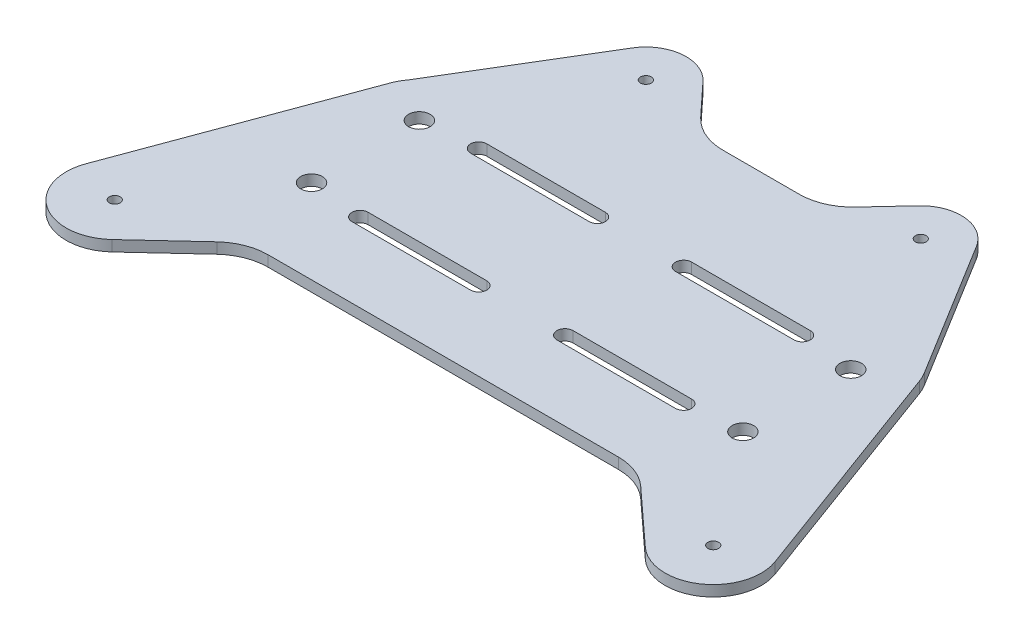
from build123d import *

# Parameters (mm, degrees)
SKETCH1_W           = 130
SKETCH1_H           = 90
BOSS_EXTRUDE2_DEPTH = 2
SKETCH2_R           = 2
CUT_EXTRUDE1_DEPTH  = 10
CUT_EXTRUDE3_DEPTH  = 10
SKETCH5_R           = 1
CUT_EXTRUDE4_DEPTH  = 10
CUT_EXTRUDE5_DEPTH  = 149.761308663
FILLET1_R           = 10


with BuildPart() as part:
    # Sketch1 → Boss-Extrude2 (new body)
    with BuildSketch(Plane(origin=(0, 0, 0), x_dir=(1, 0, 0), z_dir=(0, 1, 0))):
        with Locations((56.787418592, 40.403463793)):
            Rectangle(SKETCH1_W, SKETCH1_H)
    extrude(amount=BOSS_EXTRUDE2_DEPTH)

    # Sketch2 → Cut-Extrude1 (cut)
    with BuildSketch(Plane(origin=(0, 2, 0), x_dir=(1, 0, 0), z_dir=(0, 1, 0))):
        with Locations(Location((16.787418592, 50.403463793, 0), (0, 0, 270))):
            Circle(SKETCH2_R)
        with Locations(Location((16.787418592, 30.403463793, 0), (0, 0, 270))):
            Circle(SKETCH2_R)
        with Locations(Location((96.787418592, 50.403463793, 0), (0, 0, 270))):
            Circle(SKETCH2_R)
        with Locations(Location((96.787418592, 30.403463793, 0), (0, 0, 270))):
            Circle(SKETCH2_R)
    extrude(amount=-CUT_EXTRUDE1_DEPTH, mode=Mode.SUBTRACT)

    # Sketch4 → Cut-Extrude3 (cut)
    with BuildSketch(Plane(origin=(0, 2, 0), x_dir=(1, 0, 0), z_dir=(0, 1, 0))):
        with BuildLine():
            Line((26.787418592, 52.903463793), (48.787418592, 52.903463793))
            ThreePointArc((48.787418592, 52.903463793), (50.287418592, 51.403463793), (48.787418592, 49.903463793))
            Line((48.787418592, 49.903463793), (26.787418592, 49.903463793))
            ThreePointArc((26.787418592, 49.903463793), (25.287418592, 51.403463793), (26.787418592, 52.903463793))
        make_face()
        with BuildLine():
            Line((26.787418592, 30.903463793), (48.787418592, 30.903463793))
            ThreePointArc((48.787418592, 30.903463793), (50.287418592, 29.403463793), (48.787418592, 27.903463793))
            Line((48.787418592, 27.903463793), (26.787418592, 27.903463793))
            ThreePointArc((26.787418592, 27.903463793), (25.287418592, 29.403463793), (26.787418592, 30.903463793))
        make_face()
        with BuildLine():
            Line((64.787418592, 52.903463793), (86.787418592, 52.903463793))
            ThreePointArc((86.787418592, 52.903463793), (88.287418592, 51.403463793), (86.787418592, 49.903463793))
            Line((86.787418592, 49.903463793), (64.787418592, 49.903463793))
            ThreePointArc((64.787418592, 49.903463793), (63.287418592, 51.403463793), (64.787418592, 52.903463793))
        make_face()
        with BuildLine():
            Line((64.787418592, 30.903463793), (86.787418592, 30.903463793))
            ThreePointArc((86.787418592, 30.903463793), (88.287418592, 29.403463793), (86.787418592, 27.903463793))
            Line((86.787418592, 27.903463793), (64.787418592, 27.903463793))
            ThreePointArc((64.787418592, 27.903463793), (63.287418592, 29.403463793), (64.787418592, 30.903463793))
        make_face()
    extrude(amount=-CUT_EXTRUDE3_DEPTH, mode=Mode.SUBTRACT)

    # Sketch5 → Cut-Extrude4 (cut)
    with BuildSketch(Plane(origin=(0, 2, 0), x_dir=(1, 0, 0), z_dir=(0, 1, 0))):
        with Locations(Location((1.287418592, 9.403463793, 0), (0, 0, 270))):
            Circle(SKETCH5_R)
        with Locations(Location((112.287418592, 9.403463793, 0), (0, 0, 270))):
            Circle(SKETCH5_R)
        with Locations(Location((31.287418592, 77.903463793, 0), (0, 0, 270))):
            Circle(SKETCH5_R)
        with Locations(Location((82.287418592, 77.903463793, 0), (0, 0, 270))):
            Circle(SKETCH5_R)
    extrude(amount=-CUT_EXTRUDE4_DEPTH, mode=Mode.SUBTRACT)

    # Sketch6 → Cut-Extrude5 (cut, through all)
    with BuildSketch(Plane(origin=(0, 2, 0), x_dir=(1, 0, 0), z_dir=(0, 1, 0))):
        with BuildLine():
            Line((31.28741871, 85.403463793), (-8.212581408, 85.403463793))
            Line((-8.212581408, 85.403463793), (-8.212581408, -4.596536207))
            Line((-8.212581408, -4.596536207), (121.787418592, -4.596536207))
            Line((121.787418592, -4.596536207), (121.787418592, 85.403463793))
            Line((121.787418592, 85.403463793), (82.287418592, 85.403463793))
            ThreePointArc((82.287418592, 85.403463793), (86.000200188, 84.420000667), (88.739279438, 81.727531213))
            Line((88.739279438, 81.727531213), (104.673461226, 55.855633786))
            Line((104.673461226, 55.855633786), (120.652052787, 12.485170978))
            ThreePointArc((120.652052787, 12.485170978), (117.254615907, 2.001371169), (106.265325845, 2.830913046))
            Line((106.265325845, 2.830913046), (93.195977552, 14.805689748))
            Line((93.195977552, 14.805689748), (20.378859632, 14.805689748))
            Line((20.378859632, 14.805689748), (7.425097101, 2.787815466))
            ThreePointArc((7.425097103, 2.787815464), (-3.723088928, 1.897951505), (-7.176040156, 12.53519915))
            Line((-7.176040154, 12.53519915), (8.242814409, 54.204377623))
            Line((8.242814409, 54.204377623), (8.329286173, 54.347812353))
            ThreePointArc((8.329286173, 54.347812353), (8.794878375, 55.221885781), (9.350471922, 56.041700557))
            Line((9.350471922, 56.041700557), (24.835557745, 81.727531213))
            ThreePointArc((24.835557746, 81.727531212), (27.574637047, 84.420000696), (31.28741871, 85.403463793))
        make_face()
        with BuildLine():
            Line((82.287418592, 85.403463793), (31.28741871, 85.403463793))
            ThreePointArc((31.28741871, 85.403463793), (34.283566781, 84.779007119), (36.780790962, 83.00962282))
            Line((36.780790963, 83.009622821), (45.361476392, 73.77824166))
            Line((45.361476392, 73.77824166), (68.213360792, 73.77824166))
            Line((68.213360792, 73.77824166), (76.794046223, 83.009622821))
            ThreePointArc((76.794046223, 83.009622821), (79.291270457, 84.779007143), (82.287418592, 85.403463793))
        make_face()
    extrude(amount=-CUT_EXTRUDE5_DEPTH, mode=Mode.SUBTRACT)

    # Fillet1
    # the kernel refuses this fillet: 10 mm, written as the material it adds along each edge
    with BuildSketch(Plane(origin=(45.361476392, 2, -73.77824166), x_dir=(1, 0, 0), z_dir=(0, -1, 0))) as fillet1_piece_1:
        with BuildLine():
            CenterArc((FILLET1_R * 0.435768925154, -FILLET1_R), FILLET1_R, 90, 47.092151835)
            Line((-FILLET1_R * 0.296680724118, -FILLET1_R * 0.319178796393), (0, 0))
            Line((0, 0), (FILLET1_R * 0.435768925154, 0))
        make_face()
    extrude(amount=2)
    with BuildSketch(Plane(origin=(68.213360792, 2, -73.77824166), x_dir=(-1, 0, 0), z_dir=(0, -1, 0))) as fillet1_piece_2:
        with BuildLine():
            CenterArc((FILLET1_R * 0.435768925095, FILLET1_R), FILLET1_R, 222.907848171, 47.092151829)
            Line((-FILLET1_R * 0.296680724109, FILLET1_R * 0.31917879632), (0, 0))
            Line((0, 0), (FILLET1_R * 0.435768925095, 0))
        make_face()
    extrude(amount=2)
    with BuildSketch(Plane(origin=(93.195977552, 2, -14.805689748), x_dir=(0.7373075314629184, 0, 0.6755572544559473), z_dir=(0, -1, 0))) as fillet1_piece_3:
        with BuildLine():
            CenterArc((FILLET1_R * 0.388853005137, FILLET1_R), FILLET1_R, 227.502560825, 42.497439175)
            Line((-FILLET1_R * 0.286704249319, FILLET1_R * 0.262692468537), (0, 0))
            Line((0, 0), (FILLET1_R * 0.388853005137, 0))
        make_face()
    extrude(amount=2)
    with BuildSketch(Plane(origin=(20.378859632, 2, -14.805689748), x_dir=(1, 0, 0), z_dir=(0, -1, 0))) as fillet1_piece_4:
        with BuildLine():
            CenterArc((FILLET1_R * 0.392436109253, FILLET1_R), FILLET1_R, 227.146329541, 42.853670459)
            Line((-FILLET1_R * 0.287692200824, FILLET1_R * 0.2669069078), (0, 0))
            Line((0, 0), (FILLET1_R * 0.392436109253, 0))
        make_face()
    extrude(amount=2)
    # the kernel refuses this fillet: 10 mm, written as the material it takes off along each edge
    with BuildSketch(Plane(origin=(104.673461226, 4.496112329, -55.855633786), x_dir=(0.3457053588273583, 0, 0.9383431168171094), z_dir=(0, -1, 0))) as fillet1_2_piece_1:
        with BuildLine():
            CenterArc((FILLET1_R * 0.0998444931431, FILLET1_R), FILLET1_R, 258.596457336, 11.403542664)
            Line((-FILLET1_R * 0.0978734581483, FILLET1_R * 0.019741048632), (0, 0))
            Line((0, 0), (FILLET1_R * 0.0998444931431, 0))
        make_face()
    extrude(amount=6.992224657, mode=Mode.SUBTRACT)
    with BuildSketch(Plane(origin=(8.242814409, 3.565796653, -54.204377623), x_dir=(0.516298681525034, 0, -0.8564085890832199), z_dir=(0, -1, 0))) as fillet1_2_piece_2:
        with BuildLine():
            CenterArc((1.254824259, 9.940708785), FILLET1_R, 259.221695576, 4.53596152)
            Line((-0.615269231, 0.117127445), (0, 0))
            Line((0, 0), (0.167483992, 0))
        make_face()
    extrude(amount=5.131593306, mode=Mode.SUBTRACT)


solid = part.part
